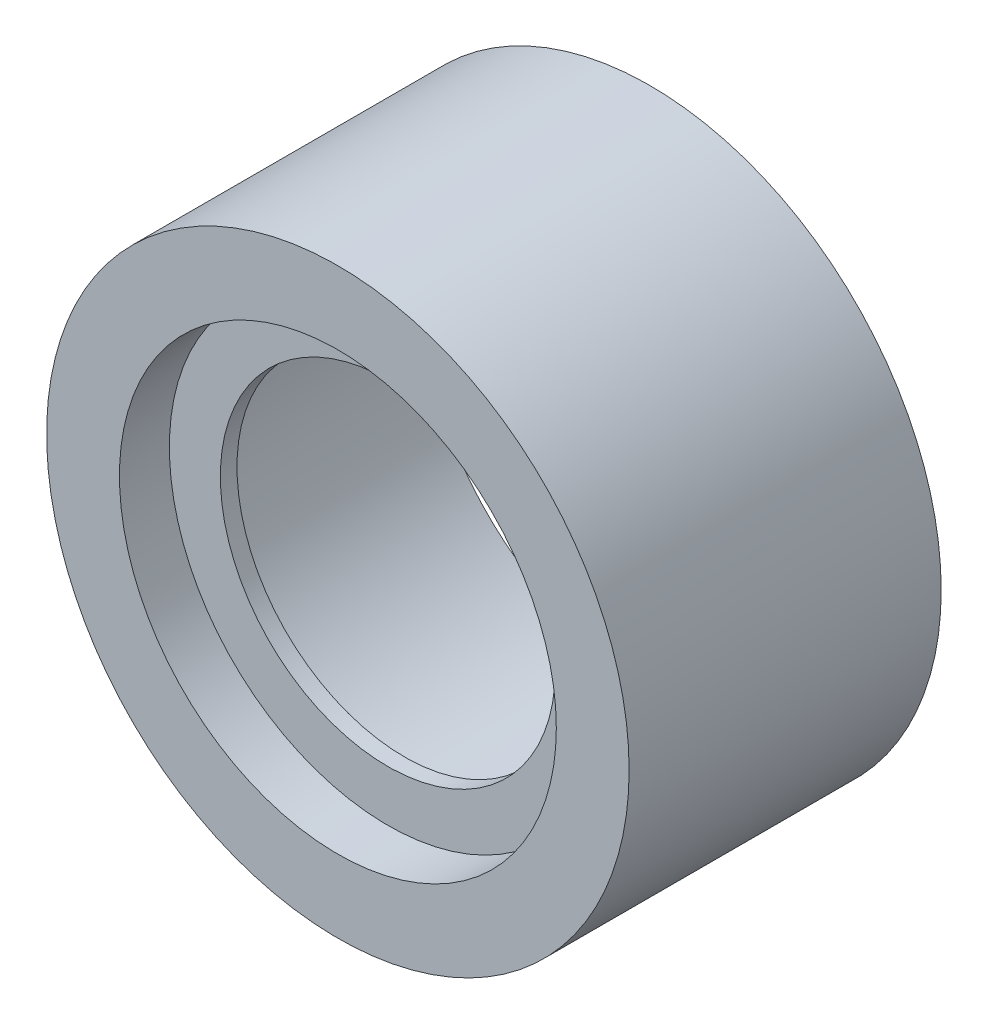
from build123d import *

# Parameters (mm, degrees)
SKETCH2_R                  = 4
CUT_EXTRUDE1_DEPTH         = 10
M8X1_25_TAPPED_HOLE2_D     = 6.8
M8X1_25_TAPPED_HOLE2_DEPTH = 19.75
M8X1_25_TAPPED_HOLE2_TIP   = 2.042926105


with BuildPart() as part:
    # Sketch1 → Revolve1 (revolve)
    with BuildSketch(Plane(origin=(0, 0, 0), x_dir=(0, 0, -1), z_dir=(1, 0, 0))):
        Polygon((-84.79575879, 52.5), (-72.79575879, 52.5), (-72.79575879, 40.25), (-68.79575879, 40.25), (-68.79575879, 55), (-9.79575879, 55), (-9.79575879, 70), (-84.79575879, 70), align=None)
    revolve(axis=Axis((0, 0, 163.822734484), (0, 0, -1)))

    # Sketch2 → Cut-Extrude1 (cut)
    with BuildSketch(Plane(origin=(0, 0, 9.79575879), x_dir=(-1, 0, 0), z_dir=(0, 0, -1))):
        with Locations((0, 62.5)):
            Circle(SKETCH2_R)
        with Locations((0, -62.5)):
            Circle(SKETCH2_R)
    extrude(amount=-CUT_EXTRUDE1_DEPTH, mode=Mode.SUBTRACT)

    # M8x1.25 Tapped Hole2
    with Locations(Plane(origin=(0, 0, 0), x_dir=(1, 0, 0), z_dir=(0, 0, -1))):
        with Locations((-54.126587737, -31.25), (-31.25, -54.126587737), (-62.5, 0), (31.25, -54.126587737), (62.5, 0), (54.126587737, 31.25), (31.25, 54.126587737), (-31.25, 54.126587737), (-54.126587737, 31.25)):
            Hole(M8X1_25_TAPPED_HOLE2_D / 2, depth=M8X1_25_TAPPED_HOLE2_DEPTH)
            with Locations((0, 0, -(M8X1_25_TAPPED_HOLE2_DEPTH + M8X1_25_TAPPED_HOLE2_TIP / 2))):  # 118° drill point
                Cone(0, M8X1_25_TAPPED_HOLE2_D / 2, M8X1_25_TAPPED_HOLE2_TIP, mode=Mode.SUBTRACT)


solid = part.part
